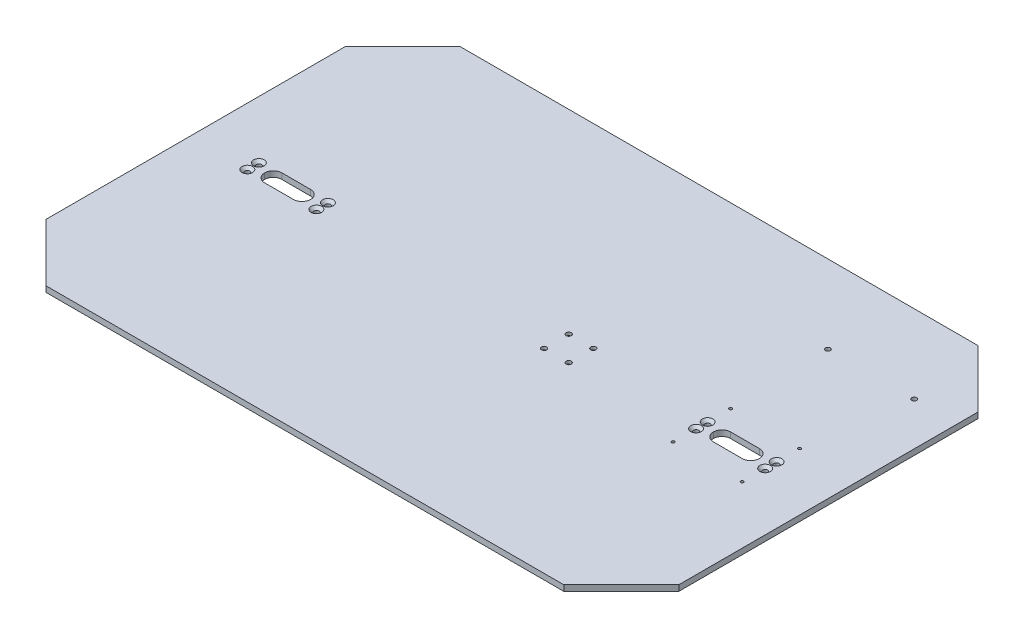
from build123d import *

# Parameters (mm, degrees)
SKETCH1_W                                            = 550
SKETCH1_H                                            = 360
BOSS_EXTRUDE1_DEPTH                                  = 5
SKETCH2_W                                            = 40
SKETCH2_H                                            = 15
CUT_EXTRUDE1_DEPTH                                   = 10
FILLET1_R                                            = 7.5
CHAMFER1_SIZE                                        = 50
SKETCH8_R                                            = 1.5
CUT_EXTRUDE5_DEPTH                                   = 10
CSK_FOR_M4_HEX_SOCKET_COUNTERSUNK_HEAD_S_D           = 4.5
CSK_FOR_M4_HEX_SOCKET_COUNTERSUNK_HEAD_S_CSINK_D     = 9.18
CSK_FOR_M4_HEX_SOCKET_COUNTERSUNK_HEAD_S_CSINK_ANGLE = 90
SKETCH10_R                                           = 2
CUT_EXTRUDE6_DEPTH                                   = 10
M5_TAPPED_HOLE1_D                                    = 4.2
M5_TAPPED_HOLE1_DEPTH                                = 12.4
M5_TAPPED_HOLE1_TIP                                  = 1.2618073
CUT_EXTRUDE8_REACH                                   = 330.71
SKETCH14_R                                           = 1.25
M3_TAPPED_HOLE1_D                                    = 2.5
M3_TAPPED_HOLE1_DEPTH                                = 7.5
M3_TAPPED_HOLE1_TIP                                  = 0.751075774
SKETCH16_R                                           = 1.5
CUT_EXTRUDE9_DEPTH                                   = 329.709598278
CSK_FOR_M4_HEX_SOCKET_COUNTERSUNK_HE_2_D             = 4.5
CSK_FOR_M4_HEX_SOCKET_COUNTERSUNK_HE_2_CSINK_D       = 9.18
CSK_FOR_M4_HEX_SOCKET_COUNTERSUNK_HE_2_CSINK_ANGLE   = 90


with BuildPart() as part:
    # Sketch1 → Boss-Extrude1 (new body)
    with BuildSketch(Plane(origin=(0, 0, 0), x_dir=(1, 0, 0), z_dir=(0, 1, 0))):
        Rectangle(SKETCH1_W, SKETCH1_H)
    extrude(amount=BOSS_EXTRUDE1_DEPTH)

    # Sketch2 → Cut-Extrude1 (cut)
    with BuildSketch(Plane(origin=(0, 5, 0), x_dir=(1, 0, 0), z_dir=(0, 1, 0))):
        with Locations((195, 0)):
            Rectangle(SKETCH2_W, SKETCH2_H)
        with Locations((-195, 0)):
            Rectangle(SKETCH2_W, SKETCH2_H)
    extrude(amount=-CUT_EXTRUDE1_DEPTH, mode=Mode.SUBTRACT)

    # Fillet1
    fillet1_edges = [part.edges().sort_by_distance(p)[0] for p in [
        (-175, 2.5, 7.5),
        (-175, 2.5, -7.5),
        (-215, 2.5, -7.5),
        (-215, 2.5, 7.5),
        (175, 2.5, 7.5),
        (175, 2.5, -7.5),
        (215, 2.5, -7.5),
        (215, 2.5, 7.5),
    ]]
    fillet(fillet1_edges, radius=FILLET1_R - 0.0001)  # a hair under: the kernel refuses the full size

    # Chamfer1
    chamfer1_edges = [part.edges().sort_by_distance(p)[0] for p in [
        (275, 2.5, 180),
        (-275, 2.5, 180),
        (-275, 2.5, -180),
        (275, 2.5, -180),
    ]]
    chamfer(chamfer1_edges, length=CHAMFER1_SIZE)

    # Sketch8 → Cut-Extrude5 (cut)
    with BuildSketch(Plane(origin=(0, 5, 0), x_dir=(1, 0, 0), z_dir=(0, 1, 0))):
        with Locations(Location((225, 5, 0), (0, 0, 270))):
            Circle(SKETCH8_R)
        with Locations(Location((165, 5, 0), (0, 0, 90))):
            Circle(SKETCH8_R)
        with Locations(Location((165, -5, 0), (0, 0, 270))):
            Circle(SKETCH8_R)
        with Locations(Location((225, -5, 0), (0, 0, 90))):
            Circle(SKETCH8_R)
        with Locations(Location((-225, -5, 0), (0, 0, 270))):
            Circle(SKETCH8_R)
        with Locations(Location((-165, -5, 0), (0, 0, 90))):
            Circle(SKETCH8_R)
        with Locations(Location((-165, 5, 0), (0, 0, 270))):
            Circle(SKETCH8_R)
        with Locations(Location((-225, 5, 0), (0, 0, 90))):
            Circle(SKETCH8_R)
    extrude(amount=-CUT_EXTRUDE5_DEPTH, mode=Mode.SUBTRACT)

    # CSK for M4 Hex Socket Countersunk Head S (through all)
    with Locations(Plane(origin=(-225, 5, -5), x_dir=(0, 0, 1), z_dir=(0, 1, 0))):
        with Locations((0, 0), (10, 0), (10, 60), (0, 60), (10, 390), (0, 390), (0, 450), (10, 450)):
            CounterSinkHole(CSK_FOR_M4_HEX_SOCKET_COUNTERSUNK_HEAD_S_D / 2, CSK_FOR_M4_HEX_SOCKET_COUNTERSUNK_HEAD_S_CSINK_D / 2, counter_sink_angle=CSK_FOR_M4_HEX_SOCKET_COUNTERSUNK_HEAD_S_CSINK_ANGLE)

    # Sketch10 → Cut-Extrude6 (cut)
    with BuildSketch(Plane(origin=(0, 5, 0), x_dir=(1, 0, 0), z_dir=(0, 1, 0))):
        with Locations(Location((237.5, 112, 0), (0, 0, 270))):
            Circle(SKETCH10_R)
        with Locations(Location((162.5, 112, 0), (0, 0, 90))):
            Circle(SKETCH10_R)
    extrude(amount=-CUT_EXTRUDE6_DEPTH, mode=Mode.SUBTRACT)

    # M5 Tapped Hole1
    with Locations(Plane(origin=(237.5, 5, -112), x_dir=(0, 0, 1), z_dir=(0, 1, 0))):
        with Locations((0, 0), (0, -75)):
            Hole(M5_TAPPED_HOLE1_D / 2, depth=M5_TAPPED_HOLE1_DEPTH)
            with Locations((0, 0, -(M5_TAPPED_HOLE1_DEPTH + M5_TAPPED_HOLE1_TIP / 2))):  # 118° drill point
                Cone(0, M5_TAPPED_HOLE1_D / 2, M5_TAPPED_HOLE1_TIP, mode=Mode.SUBTRACT)

    # Sketch14 → Cut-Extrude8 (cut, up to next)
    with BuildSketch(Plane(origin=(0, 5, 0), x_dir=(-1, 0, 0), z_dir=(0, 1, 0)), mode=Mode.PRIVATE) as cut_extrude8_sk1:
        with Locations(Location((-225, 25, 0), (0, 0, 90))):
            Circle(SKETCH14_R)
    cut_extrude8_tool1 = extrude(cut_extrude8_sk1.sketch, amount=-CUT_EXTRUDE8_REACH, mode=Mode.PRIVATE) & part.part
    # Sketch14 → Cut-Extrude8 (cut, up to next)
    with BuildSketch(Plane(origin=(0, 5, 0), x_dir=(-1, 0, 0), z_dir=(0, 1, 0)), mode=Mode.PRIVATE) as cut_extrude8_sk2:
        with Locations(Location((-225, -25, 0), (0, 0, 270))):
            Circle(SKETCH14_R)
    cut_extrude8_tool2 = extrude(cut_extrude8_sk2.sketch, amount=-CUT_EXTRUDE8_REACH, mode=Mode.PRIVATE) & part.part
    # Sketch14 → Cut-Extrude8 (cut, up to next)
    with BuildSketch(Plane(origin=(0, 5, 0), x_dir=(-1, 0, 0), z_dir=(0, 1, 0)), mode=Mode.PRIVATE) as cut_extrude8_sk3:
        with Locations(Location((-165, 25, 0), (0, 0, 270))):
            Circle(SKETCH14_R)
    cut_extrude8_tool3 = extrude(cut_extrude8_sk3.sketch, amount=-CUT_EXTRUDE8_REACH, mode=Mode.PRIVATE) & part.part
    # Sketch14 → Cut-Extrude8 (cut, up to next)
    with BuildSketch(Plane(origin=(0, 5, 0), x_dir=(-1, 0, 0), z_dir=(0, 1, 0)), mode=Mode.PRIVATE) as cut_extrude8_sk4:
        with Locations(Location((-165, -25, 0), (0, 0, 90))):
            Circle(SKETCH14_R)
    cut_extrude8_tool4 = extrude(cut_extrude8_sk4.sketch, amount=-CUT_EXTRUDE8_REACH, mode=Mode.PRIVATE) & part.part
    add(cut_extrude8_tool1.solids().sort_by_distance((225, 5, 25))[0], mode=Mode.SUBTRACT)
    add(cut_extrude8_tool2.solids().sort_by_distance((225, 5, -25))[0], mode=Mode.SUBTRACT)
    add(cut_extrude8_tool3.solids().sort_by_distance((165, 5, 25))[0], mode=Mode.SUBTRACT)
    add(cut_extrude8_tool4.solids().sort_by_distance((165, 5, -25))[0], mode=Mode.SUBTRACT)

    # M3 Tapped Hole1
    with Locations(Plane(origin=(225, 5, 25), x_dir=(0, 0, 1), z_dir=(0, 1, 0))):
        with Locations((0, 0), (0, -60), (-50, -60), (-50, 0)):
            Hole(M3_TAPPED_HOLE1_D / 2, depth=M3_TAPPED_HOLE1_DEPTH)
            with Locations((0, 0, -(M3_TAPPED_HOLE1_DEPTH + M3_TAPPED_HOLE1_TIP / 2))):  # 118° drill point
                Cone(0, M3_TAPPED_HOLE1_D / 2, M3_TAPPED_HOLE1_TIP, mode=Mode.SUBTRACT)

    # Sketch16 → Cut-Extrude9 (cut, through all)
    with BuildSketch(Plane(origin=(0, 5, 0), x_dir=(1, 0, 0), z_dir=(0, 1, 0))):
        with Locations(Location((38.6, 10.7, 0), (0, 0, 270))):
            Circle(SKETCH16_R)
        with Locations(Location((60, 10.7, 0), (0, 0, 270))):
            Circle(SKETCH16_R)
        with Locations(Location((38.6, -10.7, 0), (0, 0, 270))):
            Circle(SKETCH16_R)
        with Locations(Location((60, -10.7, 0), (0, 0, 270))):
            Circle(SKETCH16_R)
    extrude(amount=-CUT_EXTRUDE9_DEPTH, mode=Mode.SUBTRACT)

    # CSK for M4 Hex Socket Countersunk He 2 (through all)
    with Locations(Plane(origin=(60, 0, -10.7), x_dir=(0, 0, -1), z_dir=(0, -1, 0))):
        with Locations((0, 0), (0, -21.4), (-21.4, -21.4), (-21.4, 0)):
            CounterSinkHole(CSK_FOR_M4_HEX_SOCKET_COUNTERSUNK_HE_2_D / 2, CSK_FOR_M4_HEX_SOCKET_COUNTERSUNK_HE_2_CSINK_D / 2, counter_sink_angle=CSK_FOR_M4_HEX_SOCKET_COUNTERSUNK_HE_2_CSINK_ANGLE)


solid = part.part
